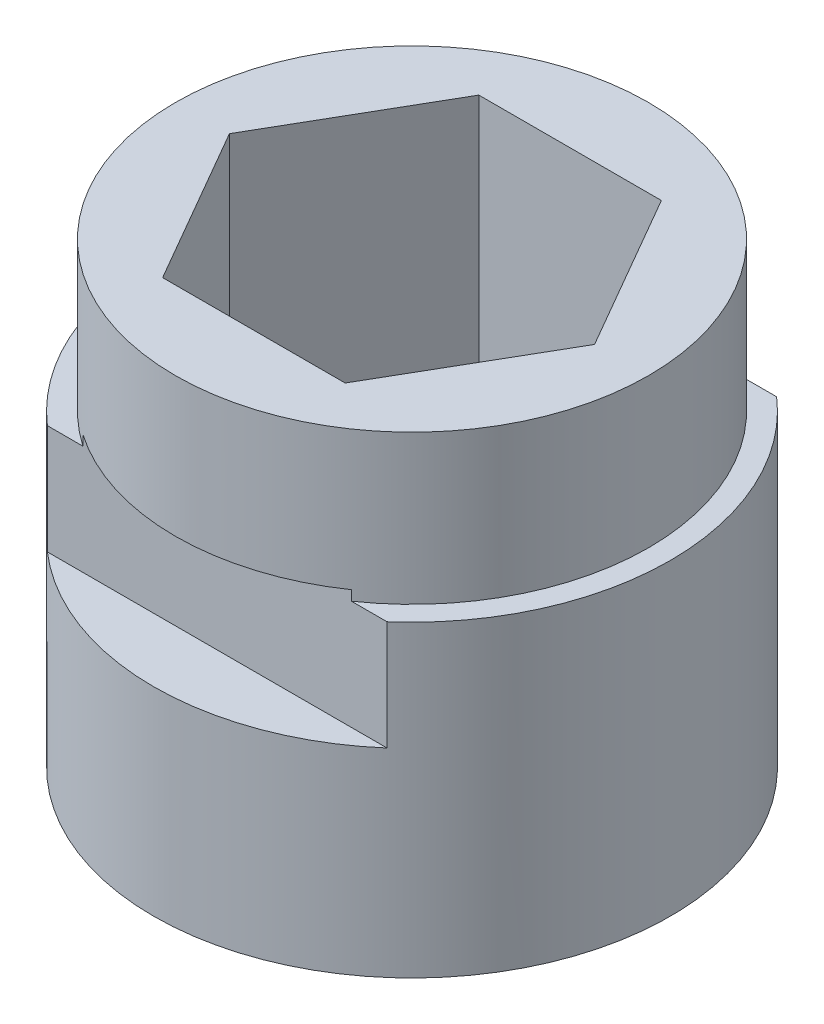
from build123d import *

# Parameters (mm, degrees)
SKETCH1_R               = 7.5565
BOSS_EXTRUDE1_DEPTH     = 13.97
BOSS_EXTRUDE2_START     = 0.635
SKETCH2_R               = 7.5565
SKETCH2_R_2             = 3.3
BOSS_EXTRUDE2_DEPTH     = 0.635
SKETCH4_R               = 8.255
SKETCH4_R_2             = 7.5565
BOSS_EXTRUDE3_DEPTH     = 9.8425
CUT_EXTRUDE1_DEPTH      = 19.205794407
CUT_EXTRUDE1_DEPTH_BACK = 19.205794407
SKETCH3_W               = 2.140633032
SKETCH3_H               = 3.81
SKETCH3_W_2             = 2.256055482


with BuildPart() as part:
    # Sketch1 → Boss-Extrude1 (new body)
    with BuildSketch(Plane(origin=(0, 0, 0), x_dir=(1, 0, 0), z_dir=(0, 1, 0))):
        Circle(SKETCH1_R)
        Polygon((-2.915618859, 5.05), (-5.831237719, 0), (-2.915618859, -5.05), (2.915618859, -5.05), (5.831237719, 0), (2.915618859, 5.05), align=None, mode=Mode.SUBTRACT)
    extrude(amount=BOSS_EXTRUDE1_DEPTH)

    # Sketch2 → Boss-Extrude2 (add)
    with BuildSketch(Plane.XZ.offset(BOSS_EXTRUDE2_START)):
        Circle(SKETCH2_R)
        Circle(SKETCH2_R_2, mode=Mode.SUBTRACT)
    extrude(amount=-BOSS_EXTRUDE2_DEPTH)

    # Sketch4 → Boss-Extrude3 (add)
    with BuildSketch(Plane.XZ.offset(0.635)):
        Circle(SKETCH4_R)
        Circle(SKETCH4_R_2, mode=Mode.SUBTRACT)
    extrude(amount=-BOSS_EXTRUDE3_DEPTH)

    # Sketch3 → Cut-Extrude1 (cut, two sides: drawn at the far end of the back side and taken through both)
    with BuildSketch(Plane(origin=(0, 0, 0), x_dir=(0, 0, -1), z_dir=(1, 0, 0)).offset(-CUT_EXTRUDE1_DEPTH_BACK)):
        with Locations((-7.293316516, 7.62)):
            Rectangle(SKETCH3_W, SKETCH3_H)
        with Locations((7.351027741, 7.62)):
            Rectangle(SKETCH3_W_2, SKETCH3_H)
    extrude(amount=CUT_EXTRUDE1_DEPTH + CUT_EXTRUDE1_DEPTH_BACK, mode=Mode.SUBTRACT)


solid = part.part
